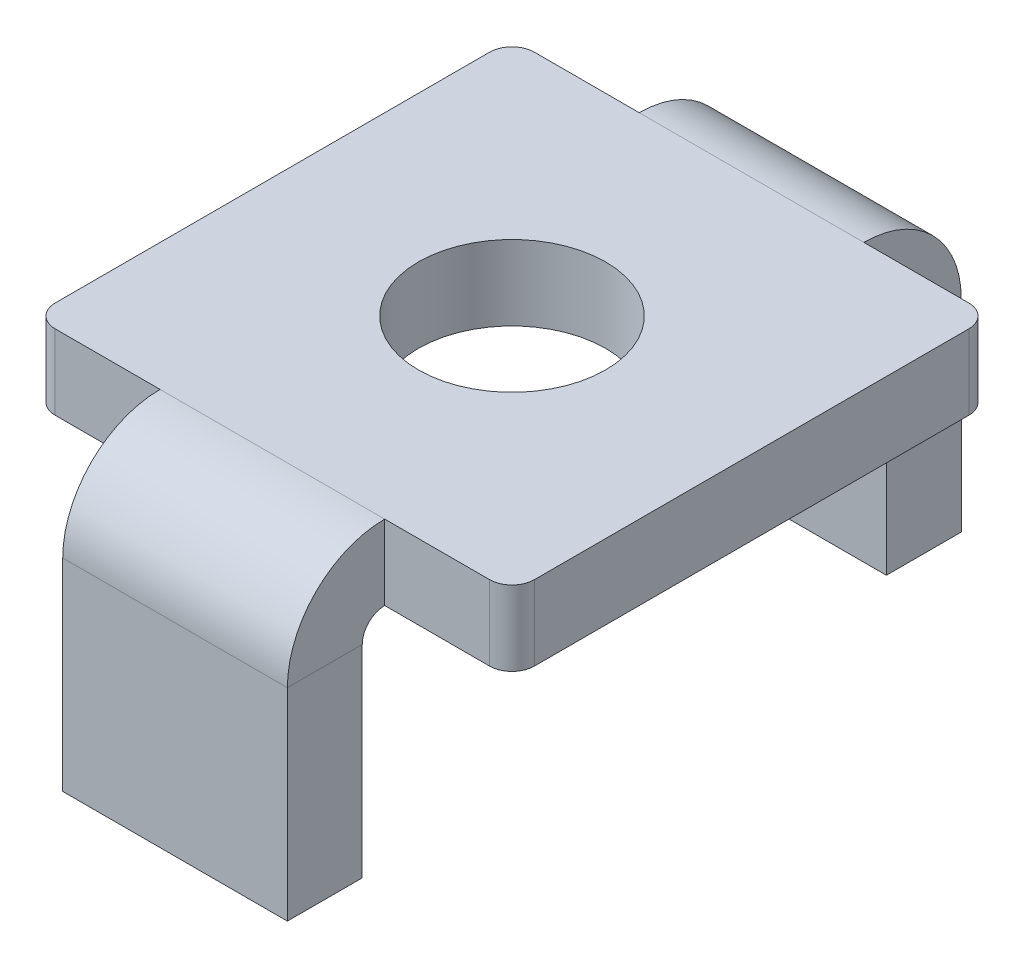
from build123d import *

# Parameters (mm, degrees)
SKETCH1_W             = 6.4
SKETCH1_H             = 6.4
BOSS_EXTRUDE1_DEPTH   = 1
M3X0_5_TAPPED_HOLE1_D = 2.5
EDGE_FLANGE1_DEPTH    = 3
FILLET1_R             = 0.3


# Sheet-metal steps are written as plain solids
with BuildPart() as part:
    # Sketch1 → Boss-Extrude1 (new body)
    with BuildSketch(Plane(origin=(0, 0, 0), x_dir=(1, 0, 0), z_dir=(0, 1, 0))):
        Rectangle(SKETCH1_W, SKETCH1_H)
    extrude(amount=BOSS_EXTRUDE1_DEPTH)

    # M3x0.5 Tapped Hole1 (through all)
    with Locations(Plane(origin=(0, 1, 0), x_dir=(1, 0, 0), z_dir=(0, 1, 0))):
        with Locations((0, 0)):
            Hole(M3X0_5_TAPPED_HOLE1_D / 2)

    # Edge-Flange1 section (across the edge) → Edge-Flange1 (add)
    with BuildSketch(Plane(origin=(1.5, 0, 3.5), x_dir=(0, 0, -1), z_dir=(-1, 0, 0))):
        with BuildLine():
            Line((-1, 0.3), (-1, 3))
            Line((-1, 3), (0, 3))
            Line((0, 3), (0, 0.3))
            ThreePointArc((0, 0.3), (0.087867966, 0.087867966), (0.3, 0))
            Line((0.3, 0), (0.3, -1))
            ThreePointArc((0.3, -1), (-0.619238816, -0.619238816), (-1, 0.3))
        make_face()
    edge_flange1 = extrude(amount=EDGE_FLANGE1_DEPTH)

    # Mirror1: Edge-Flange1 across plane
    add(edge_flange1.mirror(Plane.XY))

    # Fillet1
    fillet1_edges = [part.edges().sort_by_distance(p)[0] for p in [
        (-3.2, 0.5, 3.2),
        (3.2, 0.5, 3.2),
        (3.2, 0.5, -3.2),
        (-3.2, 0.5, -3.2),
    ]]
    fillet(fillet1_edges, radius=FILLET1_R)


solid = part.part
